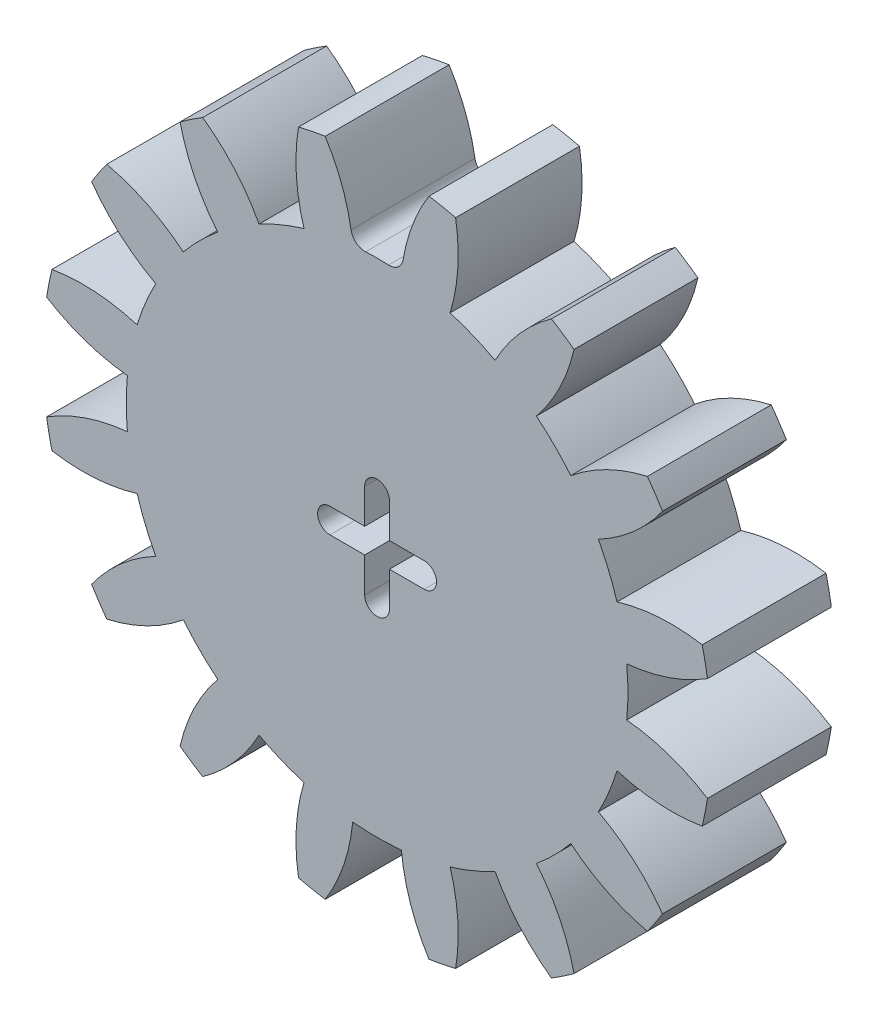
from build123d import *

# Parameters (mm, degrees)
SKETCH1_R           = 13.5
BOSS_EXTRUDE1_DEPTH = 2.5
CUT_EXTRUDE1_DEPTH  = 20.254869514
FILLET1_R           = 0.57
CIRPATTERN3_COUNT   = 16


with BuildPart() as part:
    # Sketch1 → Boss-Extrude1 (new, symmetric)
    with BuildSketch(Plane.XY):
        Circle(SKETCH1_R)
        with BuildLine():
            ThreePointArc((0.5, -1.9), (0, -2.4), (-0.5, -1.9))
            Line((-0.5, -1.9), (-0.5, -0.5))
            Line((-0.5, -0.5), (-1.9, -0.5))
            ThreePointArc((-1.9, -0.5), (-2.4, 0), (-1.9, 0.5))
            Line((-1.9, 0.5), (-0.5, 0.5))
            Line((-0.5, 0.5), (-0.5, 1.9))
            ThreePointArc((-0.5, 1.9), (0, 2.4), (0.5, 1.9))
            Line((0.5, 1.9), (0.5, 0.5))
            Line((0.5, 0.5), (1.9, 0.5))
            ThreePointArc((1.9, 0.5), (2.4, 0), (1.9, -0.5))
            Line((1.9, -0.5), (0.5, -0.5))
            Line((0.5, -0.5), (0.5, -1.9))
        make_face(mode=Mode.SUBTRACT)
    extrude(amount=BOSS_EXTRUDE1_DEPTH, both=True)

    # Sketch2 → Cut-Extrude1 (cut, symmetric)
    with BuildSketch(Plane.XY):
        with BuildLine():
            ThreePointArc((0.982234387, 10.077243701), (0, 10.125), (-0.982234387, 10.077243701))
            ThreePointArc((-0.982234387, 10.077243701), (-1.348268622, 11.771504161), (-2.092826994, 13.336794037))
            ThreePointArc((-2.092826994, 13.336794037), (0, 13.5), (2.092826994, 13.336794037))
            ThreePointArc((2.092826994, 13.336794037), (1.348268622, 11.771504161), (0.982234387, 10.077243701))
        make_face()
    cut_extrude1 = extrude(amount=CUT_EXTRUDE1_DEPTH, both=True, mode=Mode.SUBTRACT)

    # Fillet1
    fillet1_edges = [part.edges().sort_by_distance(p)[0] for p in [
        (0.982234387, 10.077243701, 0),
        (-0.982234387, 10.077243701, 0),
    ]]
    fillet(fillet1_edges, radius=FILLET1_R)

    # CirPattern3: Cut-Extrude1 ×16 about axis
    cirpattern3_axis = Axis((0, 0, 2.5), (0, 0, -1))
    for i in range(1, CIRPATTERN3_COUNT):
        add(cut_extrude1.rotate(cirpattern3_axis, i * 360 / CIRPATTERN3_COUNT), mode=Mode.SUBTRACT)


solid = part.part
